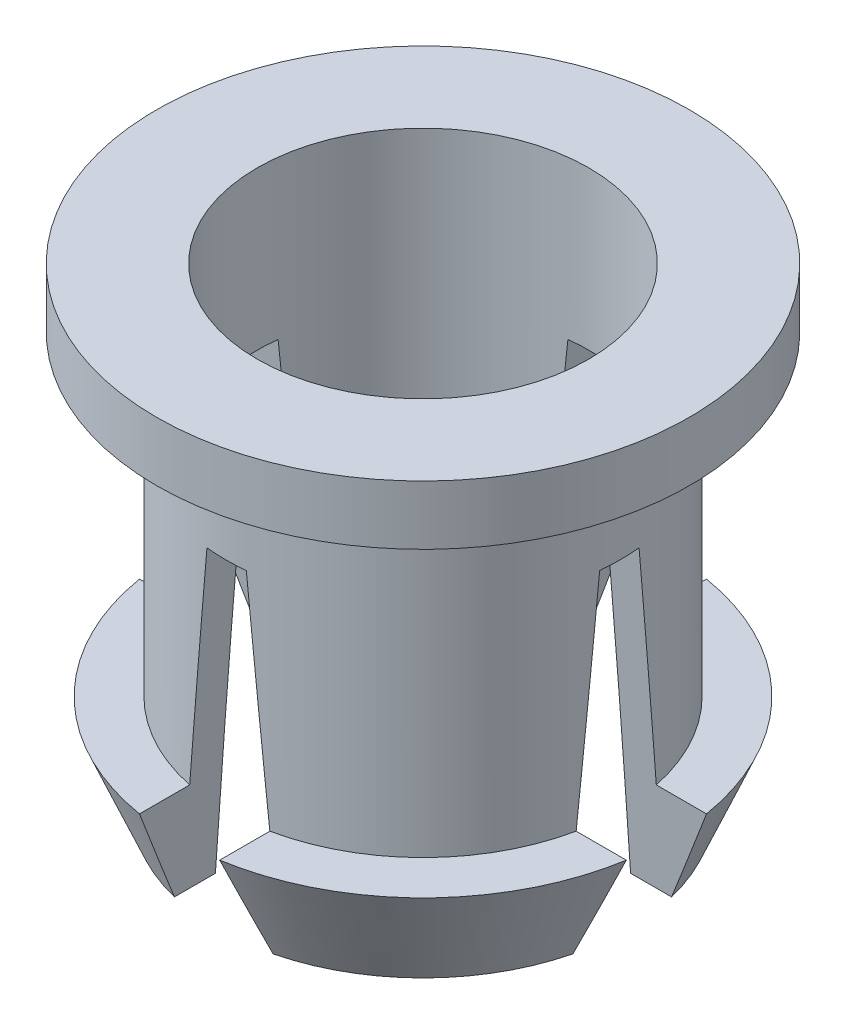
from build123d import *

# Parameters (mm, degrees)
CUT_EXTRUDE1_DEPTH = 6.637486142
CIRPATTERN1_COUNT  = 4


with BuildPart() as part:
    # Sketch1 → Revolve1 (revolve)
    with BuildSketch(Plane.XY):
        Polygon((2.1, 3), (2.1, -3), (2.6, -3), (3.125, -1.75), (2.5, -1.75), (2.5, 2.25), (3.375, 2.25), (3.375, 3), align=None)
    revolve(axis=Axis((0, 3, 0), (0, -1, 0)))

    # Sketch2 → Cut-Extrude1 (cut, symmetric)
    with BuildSketch(Plane.XY):
        Polygon((-0.249514725, 1), (0.249514725, 1), (0.625, -3), (-0.625, -3), align=None)
    cut_extrude1 = extrude(amount=CUT_EXTRUDE1_DEPTH, both=True, mode=Mode.SUBTRACT)

    # CirPattern1: Cut-Extrude1 ×4 about axis
    cirpattern1_axis = Axis((0, 3, 0), (0, 1, 0))
    for i in range(1, CIRPATTERN1_COUNT):
        add(cut_extrude1.rotate(cirpattern1_axis, i * 360 / CIRPATTERN1_COUNT), mode=Mode.SUBTRACT)


solid = part.part
